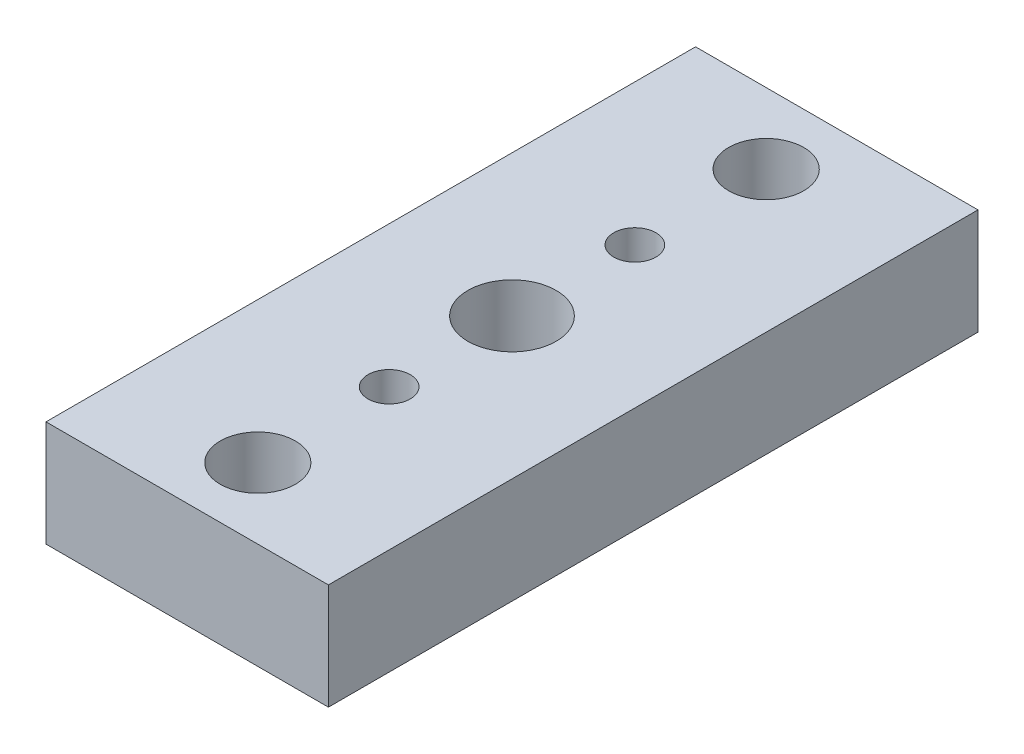
from build123d import *

# Parameters (mm, degrees)
SKETCH1_W                   = 25.4
SKETCH1_H                   = 9.525
EXTRUDE1_DEPTH              = 58.42
F_1_4_CLEARANCE_HOLE1_D     = 6.7564
F_1_4_CLEARANCE_HOLE1_DEPTH = 12.7
F_1_4_CLEARANCE_HOLE1_TIP   = 2.029827343
F_3_8_16_TAPPED_HOLE1_D     = 7.9375
F_10_24_TAPPED_HOLE1_D      = 3.7973
CIRPATTERN1_COUNT           = 2


with BuildPart() as part:
    # Sketch1 → Extrude1 (new body)
    with BuildSketch(Plane.XY):
        Rectangle(SKETCH1_W, SKETCH1_H)
    extrude(amount=EXTRUDE1_DEPTH)

    # 1/4 Clearance Hole1
    with Locations(Plane(origin=(0, 4.7625, 6.35), x_dir=(0, 0, 1), z_dir=(0, 1, 0))):
        with Locations((0, 0), (45.72, 0)):
            Hole(F_1_4_CLEARANCE_HOLE1_D / 2, depth=F_1_4_CLEARANCE_HOLE1_DEPTH)
            with Locations((0, 0, -(F_1_4_CLEARANCE_HOLE1_DEPTH + F_1_4_CLEARANCE_HOLE1_TIP / 2))):  # 118° drill point
                Cone(0, F_1_4_CLEARANCE_HOLE1_D / 2, F_1_4_CLEARANCE_HOLE1_TIP, mode=Mode.SUBTRACT)

    # 3/8-16 Tapped Hole1 (through all)
    with Locations(Plane(origin=(0, 4.7625, 29.21), x_dir=(0, 0, 1), z_dir=(0, 1, 0))):
        with Locations((0, 0)):
            Hole(F_3_8_16_TAPPED_HOLE1_D / 2)

    # #10-24 Tapped Hole1 (through all)
    with Locations(Plane(origin=(0, 4.7625, 40.259), x_dir=(0, 0, 1), z_dir=(0, 1, 0))):
        with Locations((0, 0)):
            f_10_24_tapped_hole1 = Hole(F_10_24_TAPPED_HOLE1_D / 2)

    # CirPattern1: #10-24 Tapped Hole1 ×2 about axis
    cirpattern1_axis = Axis((0, 4.7625, 29.21), (0, 1, 0))
    for i in range(1, CIRPATTERN1_COUNT):
        add(f_10_24_tapped_hole1.rotate(cirpattern1_axis, i * 360 / CIRPATTERN1_COUNT), mode=Mode.SUBTRACT)


solid = part.part
